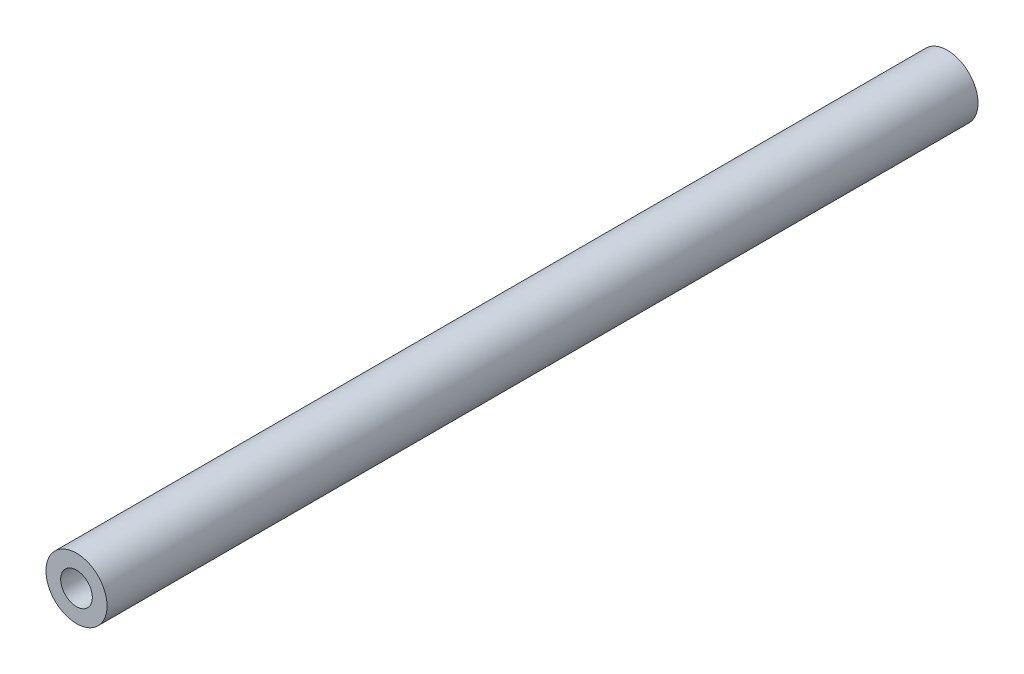
from build123d import *

# Parameters (mm, degrees)
SKETCH1_R                      = 5
BOSS_EXTRUDE1_DEPTH            = 142.53
F_6_0_204_DIAMETER_HOLE1_D     = 5.1816
F_6_0_204_DIAMETER_HOLE1_DEPTH = 30
F_6_0_204_DIAMETER_HOLE1_TIP   = 1.556709692
F_6_0_204_DIAMETER_HOLE2_D     = 5.1816
F_6_0_204_DIAMETER_HOLE2_DEPTH = 30
F_6_0_204_DIAMETER_HOLE2_TIP   = 1.556709692


with BuildPart() as part:
    # Sketch1 → Boss-Extrude1 (new body)
    with BuildSketch(Plane.XY):
        Circle(SKETCH1_R)
    extrude(amount=BOSS_EXTRUDE1_DEPTH)

    # #6 (0.204) Diameter Hole1
    with Locations(Plane(origin=(0, 0, 0), x_dir=(-1, 0, 0), z_dir=(0, 0, -1))):
        with Locations((0, 0)):
            Hole(F_6_0_204_DIAMETER_HOLE1_D / 2, depth=F_6_0_204_DIAMETER_HOLE1_DEPTH)
            with Locations((0, 0, -(F_6_0_204_DIAMETER_HOLE1_DEPTH + F_6_0_204_DIAMETER_HOLE1_TIP / 2))):  # 118° drill point
                Cone(0, F_6_0_204_DIAMETER_HOLE1_D / 2, F_6_0_204_DIAMETER_HOLE1_TIP, mode=Mode.SUBTRACT)

    # #6 (0.204) Diameter Hole2
    with Locations(Plane.XY.offset(142.53)):
        with Locations((0, 0)):
            Hole(F_6_0_204_DIAMETER_HOLE2_D / 2, depth=F_6_0_204_DIAMETER_HOLE2_DEPTH)
            with Locations((0, 0, -(F_6_0_204_DIAMETER_HOLE2_DEPTH + F_6_0_204_DIAMETER_HOLE2_TIP / 2))):  # 118° drill point
                Cone(0, F_6_0_204_DIAMETER_HOLE2_D / 2, F_6_0_204_DIAMETER_HOLE2_TIP, mode=Mode.SUBTRACT)


solid = part.part
